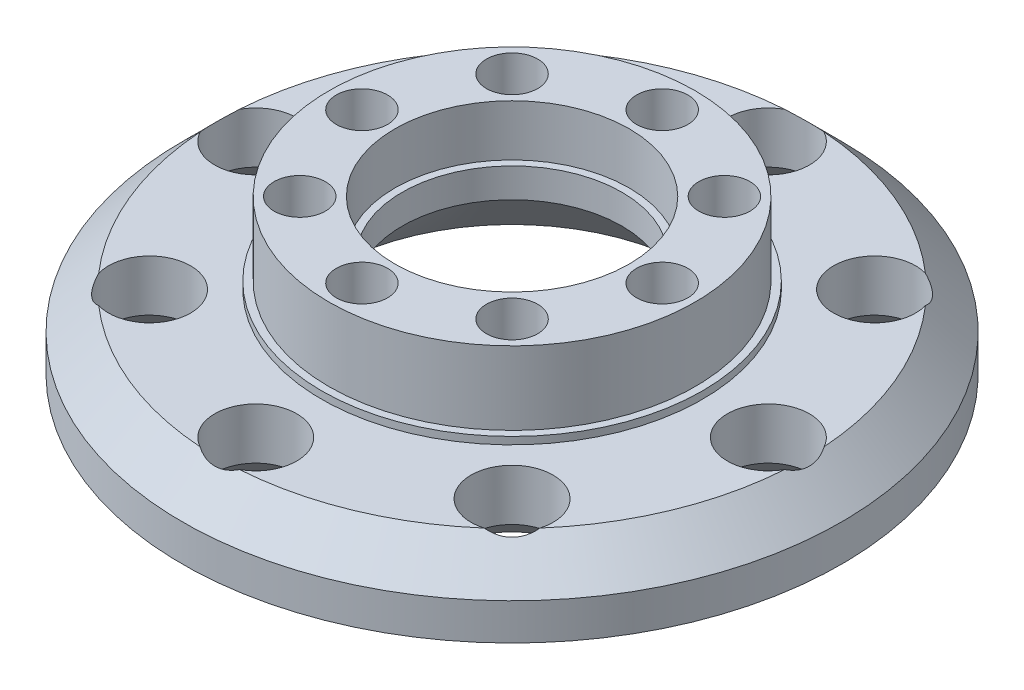
from build123d import *
from build123d.topology import SkipClean

# Parameters (mm, degrees)
SKETCH1_R           = 25
SKETCH1_R_2         = 17.5
BOSS_EXTRUDE1_DEPTH = 10
BOSS_EXTRUDE2_START = 10
SKETCH2_R           = 45
SKETCH2_R_2         = 5.6
SKETCH2_R_3         = 17.5
BOSS_EXTRUDE2_DEPTH = 10
CHAMFER1_SIZE       = 5
BOSS_EXTRUDE4_START = -20
SKETCH4_R           = 17.5
SKETCH4_R_2         = 16
BOSS_EXTRUDE4_DEPTH = 20
BOSS_EXTRUDE5_START = -20
SKETCH5_R           = 16
SKETCH5_R_2         = 15
BOSS_EXTRUDE5_DEPTH = 13
CHAMFER3_SIZE       = 10
SKETCH7_R           = 25
SKETCH7_R_2         = 16
BOSS_EXTRUDE6_DEPTH = 1
SKETCH8_R           = 16
SKETCH8_R_2         = 15
BOSS_EXTRUDE7_DEPTH = 1
SKETCH9_R           = 26
BOSS_EXTRUDE8_DEPTH = 1
CUT_EXTRUDE1_START  = -18
SKETCH10_R          = 15
CUT_EXTRUDE1_DEPTH  = 18
CHAMFER4_SIZE       = 3
SKETCH11_R          = 3.5
CUT_EXTRUDE2_DEPTH  = 5


with BuildPart() as part:
    # Sketch1 → Boss-Extrude1 (new body)
    with BuildSketch(Plane(origin=(0, 0, 0), x_dir=(1, 0, 0), z_dir=(0, 1, 0))):
        with Locations(Location((0, 0, 0), (0, 0, 270))):
            Circle(SKETCH1_R)
        with Locations(Location((0, 0, 0), (0, 0, 270))):
            Circle(SKETCH1_R_2, mode=Mode.SUBTRACT)
    extrude(amount=BOSS_EXTRUDE1_DEPTH)

    # Sketch2 → Boss-Extrude2 (add)
    with SkipClean():  # the faces are left unmerged after this step: merging them gives an invalid solid
        with BuildSketch(Plane.XZ.offset(BOSS_EXTRUDE2_START)):
            with Locations(Location((0, 0, 0), (0, 0, 270))):
                Circle(SKETCH2_R)
            with Locations(Location((35, 0, 0), (0, 0, 270))):
                Circle(SKETCH2_R_2, mode=Mode.SUBTRACT)
            with Locations(Location((24.748737342, -24.748737342, 0), (0, 0, 270))):
                Circle(SKETCH2_R_2, mode=Mode.SUBTRACT)
            with Locations(Location((0, -35, 0), (0, 0, 270))):
                Circle(SKETCH2_R_2, mode=Mode.SUBTRACT)
            with Locations(Location((-24.748737342, -24.748737342, 0), (0, 0, 270))):
                Circle(SKETCH2_R_2, mode=Mode.SUBTRACT)
            with Locations(Location((-35, 0, 0), (0, 0, 270))):
                Circle(SKETCH2_R_2, mode=Mode.SUBTRACT)
            with Locations(Location((-24.748737342, 24.748737342, 0), (0, 0, 270))):
                Circle(SKETCH2_R_2, mode=Mode.SUBTRACT)
            with Locations(Location((0, 35, 0), (0, 0, 270))):
                Circle(SKETCH2_R_2, mode=Mode.SUBTRACT)
            with Locations(Location((24.748737342, 24.748737342, 0), (0, 0, 270))):
                Circle(SKETCH2_R_2, mode=Mode.SUBTRACT)
            with Locations(Location((0, 0, 0), (0, 0, 270))):
                Circle(SKETCH2_R_3, mode=Mode.SUBTRACT)
        extrude(amount=-BOSS_EXTRUDE2_DEPTH)

    # Chamfer1
    # the kernel refuses this chamfer: 5 mm, written as the material it takes off along each edge
    with BuildSketch(Plane(origin=(0, 0, 0), x_dir=(0, 0, -1), z_dir=(-1, 0, 0))) as chamfer1_piece_1:
        Polygon((45 - CHAMFER1_SIZE, 0), (45, CHAMFER1_SIZE), (45, 0), align=None)
    revolve(axis=Axis((0, 0, 0), (0, -1, 0)), mode=Mode.SUBTRACT)

    # Sketch4 → Boss-Extrude4 (add)
    with BuildSketch(Plane(origin=(0, 10, 0), x_dir=(1, 0, 0), z_dir=(0, 1, 0)).offset(BOSS_EXTRUDE4_START)):
        Circle(SKETCH4_R)
        with Locations(Location((0, 0, 0), (0, 0, 270))):
            Circle(SKETCH4_R_2, mode=Mode.SUBTRACT)
    extrude(amount=BOSS_EXTRUDE4_DEPTH)

    # Sketch5 → Boss-Extrude5 (add)
    with BuildSketch(Plane(origin=(0, 10, 0), x_dir=(1, 0, 0), z_dir=(0, 1, 0)).offset(BOSS_EXTRUDE5_START)):
        with Locations(Location((0, 0, 0), (0, 0, 270))):
            Circle(SKETCH5_R)
        with Locations(Location((0, 0, 0), (0, 0, 270))):
            Circle(SKETCH5_R_2, mode=Mode.SUBTRACT)
    extrude(amount=BOSS_EXTRUDE5_DEPTH)

    # Chamfer3
    chamfer3_edges = [part.edges().sort_by_distance(p)[0] for p in [
        (0, -10, -15),
    ]]
    chamfer(chamfer3_edges, length=CHAMFER3_SIZE)

    # Sketch7 → Boss-Extrude6 (add)
    with BuildSketch(Plane(origin=(0, 10, 0), x_dir=(1, 0, 0), z_dir=(0, 1, 0))):
        with Locations(Location((0, 0, 0), (0, 0, 270))):
            Circle(SKETCH7_R)
        with Locations(Location((0, 0, 0), (0, 0, 270))):
            Circle(SKETCH7_R_2, mode=Mode.SUBTRACT)
    extrude(amount=BOSS_EXTRUDE6_DEPTH)

    # Sketch8 → Boss-Extrude7 (add)
    with BuildSketch(Plane(origin=(0, 3, 0), x_dir=(1, 0, 0), z_dir=(0, 1, 0))):
        with Locations(Location((0, 0, 0), (0, 0, 270))):
            Circle(SKETCH8_R)
        with Locations(Location((0, 0, 0), (0, 0, 270))):
            Circle(SKETCH8_R_2, mode=Mode.SUBTRACT)
    extrude(amount=BOSS_EXTRUDE7_DEPTH)

    # Sketch9 → Boss-Extrude8 (add)
    with BuildSketch(Plane(origin=(0, 0, 0), x_dir=(1, 0, 0), z_dir=(0, 1, 0))):
        with Locations(Location((0, 0, 0), (0, 0, 90))):
            Circle(SKETCH9_R)
    extrude(amount=BOSS_EXTRUDE8_DEPTH)

    # Sketch10 → Cut-Extrude1 (cut)
    with BuildSketch(Plane(origin=(0, 1, 0), x_dir=(1, 0, 0), z_dir=(0, 1, 0)).offset(CUT_EXTRUDE1_START)):
        with Locations(Location((0, 0, 0), (0, 0, 270))):
            Circle(SKETCH10_R)
    extrude(amount=CUT_EXTRUDE1_DEPTH, mode=Mode.SUBTRACT)

    # Chamfer4
    chamfer4_edges = [part.edges().sort_by_distance(p)[0] for p in [
        (-35, -10, 5.6),
        (-24.748737342, -10, 30.348737342),
        (0, -10, 40.6),
        (24.748737342, -10, 30.348737342),
        (35, -10, 5.6),
        (24.748737342, -10, -19.148737342),
        (0, -10, -29.4),
        (-24.748737342, -10, -19.148737342),
    ]]
    chamfer(chamfer4_edges, length=CHAMFER4_SIZE)

    # Sketch11 → Cut-Extrude2 (cut)
    with BuildSketch(Plane(origin=(0, 11, 0), x_dir=(1, 0, 0), z_dir=(0, 1, 0))):
        with Locations(Location((-20.5, 0, 0), (0, 0, 270))):
            Circle(SKETCH11_R)
        with Locations(Location((-14.495689014, 14.495689014, 0), (0, 0, 270))):
            Circle(SKETCH11_R)
        with Locations(Location((0, 20.5, 0), (0, 0, 270))):
            Circle(SKETCH11_R)
        with Locations(Location((14.495689014, 14.495689014, 0), (0, 0, 270))):
            Circle(SKETCH11_R)
        with Locations(Location((20.5, 0, 0), (0, 0, 270))):
            Circle(SKETCH11_R)
        with Locations(Location((14.495689014, -14.495689014, 0), (0, 0, 270))):
            Circle(SKETCH11_R)
        with Locations(Location((0, -20.5, 0), (0, 0, 270))):
            Circle(SKETCH11_R)
        with Locations(Location((-14.495689014, -14.495689014, 0), (0, 0, 270))):
            Circle(SKETCH11_R)
    extrude(amount=-CUT_EXTRUDE2_DEPTH, mode=Mode.SUBTRACT)


solid = part.part
